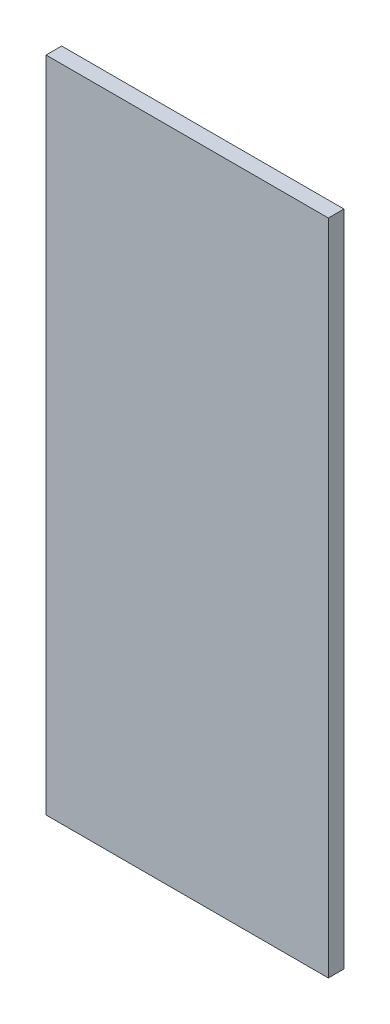
from build123d import *

# Parameters (mm, degrees)
SKETCH1_W           = 163
SKETCH1_H           = 380
BOSS_EXTRUDE1_DEPTH = 9


with BuildPart() as part:
    # Sketch1 → Boss-Extrude1 (new body)
    with BuildSketch(Plane.XY):
        Rectangle(SKETCH1_W, SKETCH1_H)
    extrude(amount=BOSS_EXTRUDE1_DEPTH)


solid = part.part
